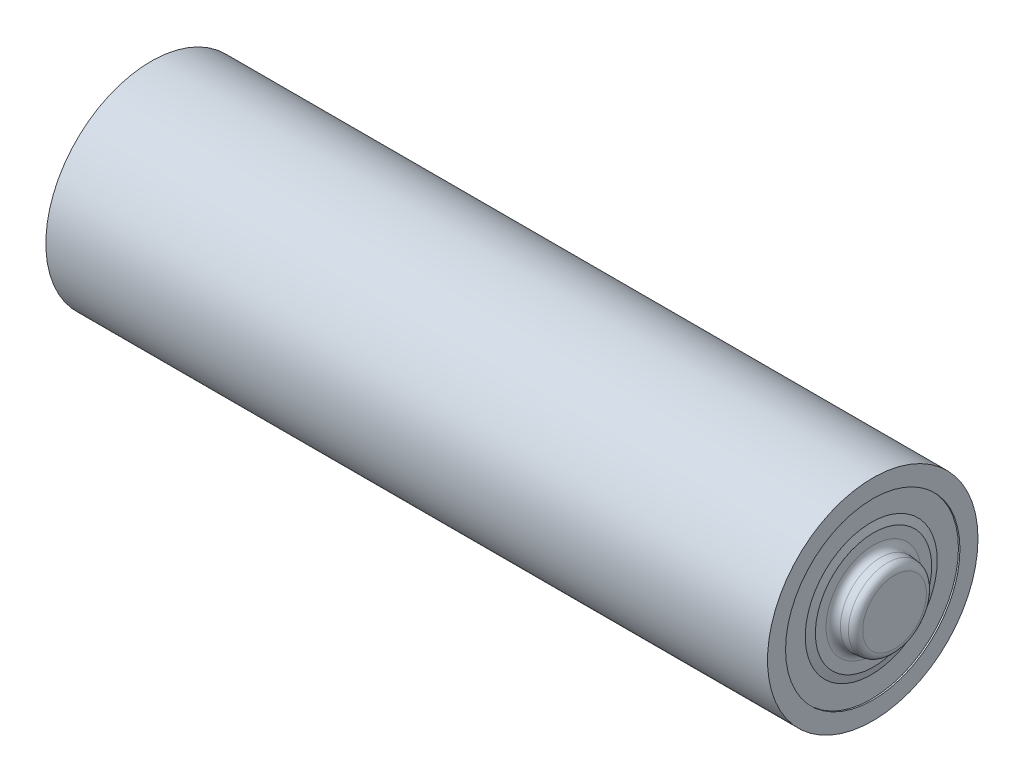
from build123d import *

# Parameters (mm, degrees)
SKETCH1_R           = 7
BOSS_EXTRUDE1_DEPTH = 48
SKETCH2_R           = 5.8
CUT_EXTRUDE1_DEPTH  = 0.1
SKETCH3_R           = 5.25
CUT_EXTRUDE2_DEPTH  = 0.1
SKETCH4_R           = 5.05
SKETCH4_R_2         = 3.45
BOSS_EXTRUDE2_DEPTH = 0.1
FILLET1_R           = 0.5
SKETCH5_R           = 3.35
BOSS_EXTRUDE3_DEPTH = 0.1
BOSS_EXTRUDE3_TAPER = 46
FILLET4_R           = 0.1
SKETCH6_R           = 4.39
BOSS_EXTRUDE4_DEPTH = 0.15
BOSS_EXTRUDE4_TAPER = 74
SKETCH7_R           = 2.7
BOSS_EXTRUDE5_DEPTH = 1.4
BOSS_EXTRUDE5_TAPER = 5
FILLET5_R           = 0.5
FILLET6_R           = 0.5


with BuildPart() as part:
    # Sketch1 → Boss-Extrude1 (new body)
    with BuildSketch(Plane(origin=(0, 0, 0), x_dir=(0, 0, -1), z_dir=(1, 0, 0))):
        Circle(SKETCH1_R)
    extrude(amount=BOSS_EXTRUDE1_DEPTH)

    # Sketch2 → Cut-Extrude1 (cut)
    with BuildSketch(Plane(origin=(48, 0, 0), x_dir=(0, 0, -1), z_dir=(1, 0, 0))):
        Circle(SKETCH2_R)
    extrude(amount=-CUT_EXTRUDE1_DEPTH, mode=Mode.SUBTRACT)

    # Sketch3 → Cut-Extrude2 (cut)
    with BuildSketch(Plane.ZY):
        Circle(SKETCH3_R)
    extrude(amount=-CUT_EXTRUDE2_DEPTH, mode=Mode.SUBTRACT)

    # Sketch4 → Boss-Extrude2 (add)
    with BuildSketch(Plane.ZY.offset(-0.1)):
        Circle(SKETCH4_R)
        Circle(SKETCH4_R_2, mode=Mode.SUBTRACT)
    extrude(amount=BOSS_EXTRUDE2_DEPTH)

    # Fillet1
    # the kernel refuses this fillet: 0.5 mm, written as the material it takes off along each edge
    with BuildSketch(Plane(origin=(0, 0, 0), x_dir=(0, 0, 1), z_dir=(0, -1, 0))) as fillet1_piece_1:
        with BuildLine():
            CenterArc((4.75, -0.5), FILLET1_R, 53.130102354, 36.869897646)
            Line((4.75, 0), (4.75, 0.01))
            Line((4.75, 0.01), (5.05, 0.01))
            Line((5.05, 0.01), (5.06, 0))
            ThreePointArc((5.06, 0), (5.06, -0.05), (5.056, -0.092))
            Line((5.056, -0.092), (5.05, -0.1))
        make_face()
    revolve(axis=Axis((0, 0, 0), (-1, 0, 0)), mode=Mode.SUBTRACT)
    with BuildSketch(Plane(origin=(0, 0, 0), x_dir=(0, 0, 1), z_dir=(0, -1, 0))) as fillet1_piece_2:
        with BuildLine():
            CenterArc((3.75, -0.5), FILLET1_R, 90, 36.869897646)
            Line((3.45, -0.1), (3.444, -0.092))
            ThreePointArc((3.444, -0.092), (3.44, -0.05), (3.44, 0))
            Line((3.44, 0), (3.45, 0.01))
            Line((3.45, 0.01), (3.75, 0.01))
            Line((3.75, 0.01), (3.75, 0))
        make_face()
    revolve(axis=Axis((0, 0, 0), (-1, 0, 0)), mode=Mode.SUBTRACT)

    # Sketch5 → Boss-Extrude3 (add)
    with BuildSketch(Plane.ZY.offset(-0.1)):
        Circle(SKETCH5_R)
    extrude(amount=BOSS_EXTRUDE3_DEPTH, taper=BOSS_EXTRUDE3_TAPER)

    # Fillet4
    fillet4_edges = [part.edges().sort_by_distance(p)[0] for p in [
        (0.1, 0, -3.45),
        (0.1, 0, -3.35),
        (0, 0, -3.246446969),
    ]]
    fillet(fillet4_edges, radius=FILLET4_R)

    # Sketch6 → Boss-Extrude4 (add)
    with BuildSketch(Plane(origin=(47.9, 0, 0), x_dir=(0, 0, -1), z_dir=(1, 0, 0))):
        Circle(SKETCH6_R)
    extrude(amount=BOSS_EXTRUDE4_DEPTH, taper=BOSS_EXTRUDE4_TAPER)

    # Sketch7 → Boss-Extrude5 (add)
    with BuildSketch(Plane(origin=(48.05, 0, 0), x_dir=(0, 0, -1), z_dir=(1, 0, 0))):
        Circle(SKETCH7_R)
    extrude(amount=BOSS_EXTRUDE5_DEPTH, taper=BOSS_EXTRUDE5_TAPER)

    # Fillet5
    fillet5_edges = [part.edges().sort_by_distance(p)[0] for p in [
        (48.05, 0, 2.7),
    ]]
    fillet(fillet5_edges, radius=FILLET5_R)

    # Fillet6
    fillet6_edges = [part.edges().sort_by_distance(p)[0] for p in [
        (49.45, 0, 2.577515871),
    ]]
    fillet(fillet6_edges, radius=FILLET6_R)


solid = part.part
